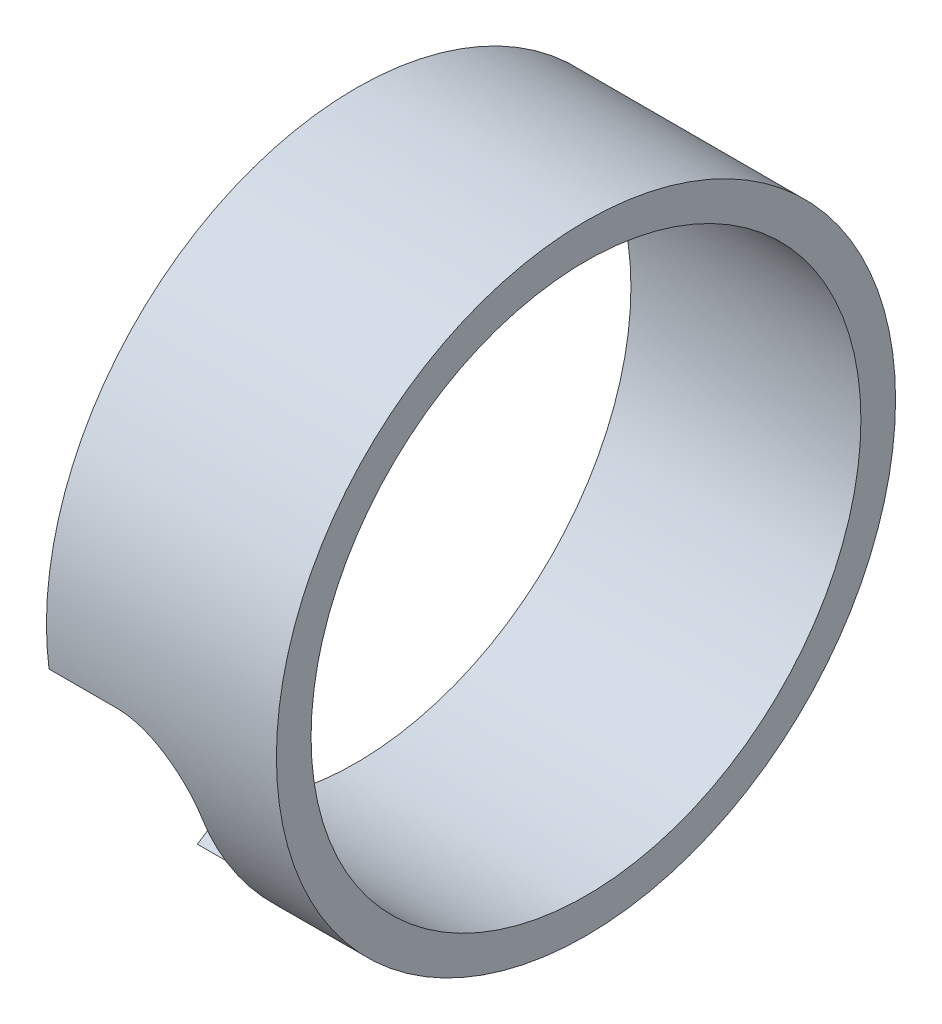
from build123d import *

# Parameters (mm, degrees)
SKETCH1_W          = 6.485999982
SKETCH1_H          = 0.977250014
CUT_EXTRUDE1_REACH = 42.92


with BuildPart() as part:
    # Sketch1 → Revolve1 (revolve)
    with BuildSketch(Plane.XY):
        with Locations((-35.769999961, 8.242624993)):
            Rectangle(SKETCH1_W, SKETCH1_H)
    revolve(axis=Axis((0, 0, 0), (-1, 0, 0)))

    # Sketch3 → Cut-Extrude1 (cut, up to next)
    with BuildSketch(Plane(origin=(0, 0, 0), x_dir=(1, 0, 0), z_dir=(0, -0.5489793709221448, 0.835835899146433)), mode=Mode.PRIVATE) as cut_extrude1_sk1:
        with BuildLine():
            Line((-39.012999952, 3.81), (-39.012999952, -3.81))
            Line((-39.012999952, -3.81), (-37.107999952, -3.81))
            ThreePointArc((-37.107999952, -3.81), (-35.760961534, -3.252038418), (-35.202999952, -1.905))
            Line((-35.202999952, -1.905), (-35.202999952, 1.905))
            ThreePointArc((-35.202999952, 1.905), (-35.760961534, 3.252038418), (-37.107999952, 3.81))
            Line((-37.107999952, 3.81), (-39.012999952, 3.81))
        make_face()
    cut_extrude1_tool1 = extrude(cut_extrude1_sk1.sketch, amount=CUT_EXTRUDE1_REACH, mode=Mode.PRIVATE) & part.part
    add(cut_extrude1_tool1.solids().sort_by_distance((-37.191875, 0, 0))[0], mode=Mode.SUBTRACT)


solid = part.part
